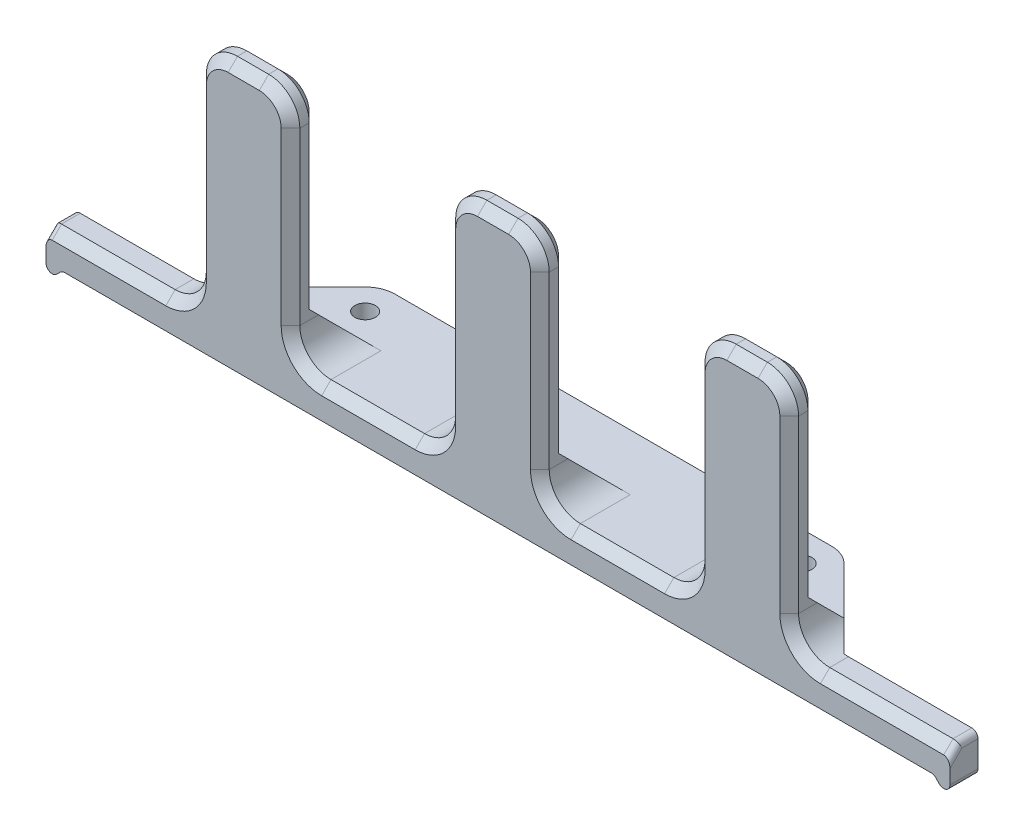
from build123d import *

# Parameters (mm, degrees)
BOSS_EXTRUDE1_DEPTH = 4.5
SKETCH2_R           = 1.6500000000000021
BOSS_EXTRUDE2_DEPTH = 3
CHAMFER1_SIZE       = 5
FILLET1_R           = 5
FILLET2_R           = 5
CHAMFER2_SIZE       = 1.5
CHAMFER3_SIZE       = 1.5
FILLET3_R           = 1


with BuildPart() as part:
    # Sketch1 → Boss-Extrude1 (new body)
    with BuildSketch(Plane.XY):
        Polygon((119.21826692136499, -13.385786437626857), (104.21826692136499, -13.38578643762686), (104.21826692136499, -50.8), (79.218266921365, -50.8), (79.218266921365, -13.385786437626857), (64.218266921365, -13.38578643762686), (64.218266921365, -50.8), (39.218266921365, -50.8), (39.21826692136499, -13.385786437627136), (24.218266921364993, -13.38578643762714), (24.21826692136499, -50.8), (0, -50.79999999999999), (0, -58.38578643762687), (2.5857864376269135, -55.8), (142.4142135623731, -55.8), (145, -58.38578643762691), (145, -50.8), (119.21826692136499, -50.8), align=None)
    extrude(amount=BOSS_EXTRUDE1_DEPTH)

    # Sketch2 → Boss-Extrude2 (add)
    with BuildSketch(Plane(origin=(0, -53.8, 0), x_dir=(1, 0, 0), z_dir=(0, 1, 0))):
        with BuildLine():
            Line((123.50544023729859, 2.968e-14), (110.90639087969068, 12.59904935760797))
            ThreePointArc((110.90639087969068, 12.59904935760797), (109.34915880534766, 13.639558563966734), (107.5122783299952, 14.004936807912568))
            Line((107.5122783299952, 14.004936807912568), (37.48772167000479, 14.004936807912571))
            ThreePointArc((37.48772167000479, 14.004936807912571), (35.65084119465232, 13.639558563966755), (34.093609120309296, 12.599049357607985))
            Line((34.093609120309296, 12.599049357607985), (21.4945597627013, -1.69e-15))
            Line((21.4945597627013, -1.69e-15), (123.50544023729859, 2.968e-14))
        make_face()
        with Locations(Location((37.48772167000473, 9.204936807912581, 0), (0, 0, 90))):
            Circle(SKETCH2_R, mode=Mode.SUBTRACT)
        with Locations(Location((107.51227832999525, 9.204936807912581, 0), (0, 0, 90))):
            Circle(SKETCH2_R, mode=Mode.SUBTRACT)
    extrude(amount=BOSS_EXTRUDE2_DEPTH)

    # Chamfer1
    # the kernel refuses this chamfer: 5 mm, written as the material it adds along each edge
    with BuildSketch(Plane(origin=(24.218266921364993, -50.8, 8.6e-16), x_dir=(0, -0.02749587661059184, -0.9996219169112965), z_dir=(1, 0, -3.1e-16))) as chamfer1_piece_1_section:
        Polygon((CHAMFER1_SIZE * 0.999621916911, CHAMFER1_SIZE * 0.0274958766106), (-CHAMFER1_SIZE * 0.0274958766106, CHAMFER1_SIZE * 0.999621916911), (0, 0), align=None)
    chamfer1_piece_1 = extrude(amount=15.000000000000007, mode=Mode.PRIVATE)
    chamfer1_piece_1 = split(chamfer1_piece_1, bisect_by=Plane(origin=(27.458586857581327, -49.136179349739656, -5.964027094880023), z_dir=(0.7071067811865472, 0, 0.7071067811865478)), keep=Keep.TOP, mode=Mode.PRIVATE)
    add(chamfer1_piece_1)
    with BuildSketch(Plane(origin=(64.218266921365, -50.8, -1.145e-14), x_dir=(0, -0.02749587661058908, -0.9996219169112968), z_dir=(1, 0, -3.1e-16))) as chamfer1_piece_2:
        Polygon((CHAMFER1_SIZE * 0.999621916911, CHAMFER1_SIZE * 0.0274958766106), (-CHAMFER1_SIZE * 0.0274958766106, CHAMFER1_SIZE * 0.999621916911), (0, 0), align=None)
    extrude(amount=15)
    with BuildSketch(Plane(origin=(104.21826692136499, -50.8, -2.375e-14), x_dir=(0, 0.9996219169112965, 0.027495876610591035), z_dir=(1, 0, -3.1e-16))) as chamfer1_piece_3_section:
        Polygon((CHAMFER1_SIZE * 0.999621916911, -CHAMFER1_SIZE * 0.0274958766106), (-CHAMFER1_SIZE * 0.0274958766106, -CHAMFER1_SIZE * 0.999621916911), (0, 0), align=None)
    chamfer1_piece_3 = extrude(amount=15, mode=Mode.PRIVATE)
    chamfer1_piece_3 = split(chamfer1_piece_3, bisect_by=Plane(origin=(116.78603436653776, -49.14998540496001, -6.719405870760873), z_dir=(-0.7071067811865483, 0, 0.7071067811865467)), keep=Keep.TOP, mode=Mode.PRIVATE)
    add(chamfer1_piece_3)

    # Fillet1
    fillet1_edges = [part.edges().sort_by_distance(p)[0] for p in [
        (39.218266921365, -50.80000000000099, -0.24999999999926015),
        (64.218266921365, -50.80000000000099, -0.24999999999926015),
        (79.218266921365, -50.80000000000099, -0.24999999999926015),
        (104.218266921365, -50.799999999999, -0.24999999999926015),
        (119.21826692136499, -50.799999999999145, 0.10641334203299913),
        (24.218266921364997, -50.80000000000054, 0.8881464206679999),
    ]]
    fillet(fillet1_edges, radius=FILLET1_R)

    # Fillet2
    fillet2_edges = [part.edges().sort_by_distance(p)[0] for p in [
        (24.218266921364993, -13.38578643762714, 2.25),
        (39.21826692136499, -13.385786437627136, 2.25),
        (64.218266921365, -13.38578643762686, 2.25),
        (79.218266921365, -13.385786437626857, 2.25),
        (104.21826692136499, -13.38578643762686, 2.25),
        (119.21826692136499, -13.385786437626855, 2.25),
    ]]
    fillet(fillet2_edges, radius=FILLET2_R)

    # Chamfer2
    # the kernel refuses this chamfer: 1.5 mm, written as the material it takes off along each edge
    with BuildSketch(Plane(origin=(114.218266921365, -13.385786437626859, 0), x_dir=(0, -0.9996219169112968, -0.02749587661058636), z_dir=(-1, -2.4e-16, 0))) as chamfer2_piece_1:
        Polygon((CHAMFER2_SIZE * 0.999621916911, CHAMFER2_SIZE * 0.0274958766106), (-CHAMFER2_SIZE * 0.0274958766106, CHAMFER2_SIZE * 0.999621916911), (0, 0), align=None)
    extrude(amount=5, mode=Mode.SUBTRACT)
    with BuildSketch(Plane(origin=(119.218266921365, -49.65752448195035, 0), x_dir=(0.02749587661058217, 0, 0.9996219169112969), z_dir=(0, 1, 0))) as chamfer2_piece_2_section:
        Polygon((CHAMFER2_SIZE * 0.999621916911, -CHAMFER2_SIZE * 0.0274958766106), (-CHAMFER2_SIZE * 0.0274958766106, -CHAMFER2_SIZE * 0.999621916911), (0, 0), align=None)
    chamfer2_piece_2 = extrude(amount=31.27173804432349, mode=Mode.PRIVATE)
    chamfer2_piece_2 = split(chamfer2_piece_2, bisect_by=Plane(origin=(118.72073896252428, -38.57940955340098, 7.220590446608273), z_dir=(0, 0.7071067811868302, -0.7071067811862648)), keep=Keep.TOP, mode=Mode.PRIVATE)
    add(chamfer2_piece_2, mode=Mode.SUBTRACT)
    with BuildSketch(Plane(origin=(104.21826692136499, -18.38578643762686, 0), x_dir=(0.9996219169112968, 0, -0.02749587661058662), z_dir=(0, -1, 0))) as chamfer2_piece_3_section:
        Polygon((CHAMFER2_SIZE * 0.999621916911, CHAMFER2_SIZE * 0.0274958766106), (-CHAMFER2_SIZE * 0.0274958766106, CHAMFER2_SIZE * 0.999621916911), (0, 0), align=None)
    chamfer2_piece_3 = extrude(amount=31.27173804432348, mode=Mode.PRIVATE)
    chamfer2_piece_3 = split(chamfer2_piece_3, bisect_by=Plane(origin=(104.71579488020573, -38.579409553400986, 7.220590446608265), z_dir=(0, 0.7071067811868302, -0.7071067811862648)), keep=Keep.TOP, mode=Mode.PRIVATE)
    add(chamfer2_piece_3, mode=Mode.SUBTRACT)
    with BuildSketch(Plane(origin=(109.218266921365, -18.385786437626862, 0), x_dir=(0, 1, 0), z_dir=(1, 0, 0))) as chamfer2_piece_4:
        Polygon((5 - CHAMFER2_SIZE, 0), (5, CHAMFER2_SIZE), (5, 0), align=None)
    revolve(axis=Axis((109.218266921365, -18.385786437626862, 0), (0, 0, 1)), revolution_arc=90, mode=Mode.SUBTRACT)
    with BuildSketch(Plane(origin=(114.218266921365, -18.385786437626855, 0), x_dir=(1, 0, 0), z_dir=(0, -1, 0))) as chamfer2_piece_5:
        Polygon((5, CHAMFER2_SIZE), (5 - CHAMFER2_SIZE, 0), (5, 0), align=None)
    revolve(axis=Axis((114.218266921365, -18.385786437626855, 0), (0, 0, 1)), revolution_arc=90, mode=Mode.SUBTRACT)
    with BuildSketch(Plane(origin=(74.218266921365, -13.385786437626859, 0), x_dir=(0, 0.027495876610586778, 0.9996219169112968), z_dir=(-1, -2.4e-16, 0))) as chamfer2_piece_6:
        Polygon((CHAMFER2_SIZE * 0.999621916911, -CHAMFER2_SIZE * 0.0274958766106), (-CHAMFER2_SIZE * 0.0274958766106, -CHAMFER2_SIZE * 0.999621916911), (0, 0), align=None)
    extrude(amount=5, mode=Mode.SUBTRACT)
    with BuildSketch(Plane(origin=(79.218266921365, -49.65752448195035, 0), x_dir=(0.027495876610582157, 0, 0.9996219169112969), z_dir=(0, 1, 0))) as chamfer2_piece_7_section:
        Polygon((CHAMFER2_SIZE * 0.999621916911, -CHAMFER2_SIZE * 0.0274958766106), (-CHAMFER2_SIZE * 0.0274958766106, -CHAMFER2_SIZE * 0.999621916911), (0, 0), align=None)
    chamfer2_piece_7 = extrude(amount=31.27173804432349, mode=Mode.PRIVATE)
    chamfer2_piece_7 = split(chamfer2_piece_7, bisect_by=Plane(origin=(78.72073896252427, -38.579409553386625, 7.220590446607076), z_dir=(0, 0.7071067811862648, -0.7071067811868302)), keep=Keep.TOP, mode=Mode.PRIVATE)
    add(chamfer2_piece_7, mode=Mode.SUBTRACT)
    with BuildSketch(Plane(origin=(64.218266921365, -18.38578643762686, 0), x_dir=(-0.02749587661058215, 0, 0.9996219169112969), z_dir=(0, -1, 0))) as chamfer2_piece_8_section:
        Polygon((CHAMFER2_SIZE * 0.999621916911, -CHAMFER2_SIZE * 0.0274958766106), (-CHAMFER2_SIZE * 0.0274958766106, -CHAMFER2_SIZE * 0.999621916911), (0, 0), align=None)
    chamfer2_piece_8 = extrude(amount=31.27173804432348, mode=Mode.PRIVATE)
    chamfer2_piece_8 = split(chamfer2_piece_8, bisect_by=Plane(origin=(64.71579488020572, -38.57940955338663, 7.220590446607069), z_dir=(0, 0.7071067811862648, -0.7071067811868302)), keep=Keep.TOP, mode=Mode.PRIVATE)
    add(chamfer2_piece_8, mode=Mode.SUBTRACT)
    with BuildSketch(Plane(origin=(69.218266921365, -18.385786437626862, 0), x_dir=(-1, 0, 0), z_dir=(0, -1, 0))) as chamfer2_piece_9:
        Polygon((5, -CHAMFER2_SIZE), (5 - CHAMFER2_SIZE, 0), (5, 0), align=None)
    revolve(axis=Axis((69.218266921365, -18.385786437626862, 0), (0, 0, -1)), revolution_arc=90, mode=Mode.SUBTRACT)
    with BuildSketch(Plane(origin=(74.218266921365, -18.385786437626855, 0), x_dir=(0, 1, 0), z_dir=(-1, 0, 0))) as chamfer2_piece_10:
        Polygon((5, -CHAMFER2_SIZE), (5 - CHAMFER2_SIZE, 0), (5, 0), align=None)
    revolve(axis=Axis((74.218266921365, -18.385786437626855, 0), (0, 0, -1)), revolution_arc=90, mode=Mode.SUBTRACT)
    with BuildSketch(Plane(origin=(34.218266921365, -13.385786437627138, 0), x_dir=(0, 0.027495876610586778, 0.9996219169112968), z_dir=(-1, -2.4e-16, 0))) as chamfer2_piece_11:
        Polygon((CHAMFER2_SIZE * 0.999621916911, -CHAMFER2_SIZE * 0.0274958766106), (-CHAMFER2_SIZE * 0.0274958766106, -CHAMFER2_SIZE * 0.999621916911), (0, 0), align=None)
    extrude(amount=5, mode=Mode.SUBTRACT)
    with BuildSketch(Plane(origin=(39.218266921365, -49.65752448195034, 0), x_dir=(0.027495876610586757, 0, 0.9996219169112968), z_dir=(0, 1, 0))) as chamfer2_piece_12_section:
        Polygon((CHAMFER2_SIZE * 0.999621916911, -CHAMFER2_SIZE * 0.0274958766106), (-CHAMFER2_SIZE * 0.0274958766106, -CHAMFER2_SIZE * 0.999621916911), (0, 0), align=None)
    chamfer2_piece_12 = extrude(amount=31.2717380443232, mode=Mode.PRIVATE)
    chamfer2_piece_12 = split(chamfer2_piece_12, bisect_by=Plane(origin=(38.72073896252428, -38.579409553386704, 7.220590446606996), z_dir=(0, 0.7071067811862648, -0.7071067811868302)), keep=Keep.TOP, mode=Mode.PRIVATE)
    add(chamfer2_piece_12, mode=Mode.SUBTRACT)
    with BuildSketch(Plane(origin=(24.218266921364993, -18.38578643762714, 0), x_dir=(-0.027495876610582153, 0, 0.9996219169112969), z_dir=(-9e-17, -1, 0))) as chamfer2_piece_13_section:
        Polygon((CHAMFER2_SIZE * 0.999621916911, -CHAMFER2_SIZE * 0.0274958766106), (-CHAMFER2_SIZE * 0.0274958766106, -CHAMFER2_SIZE * 0.999621916911), (0, 0), align=None)
    chamfer2_piece_13 = extrude(amount=31.271738044323207, mode=Mode.PRIVATE)
    chamfer2_piece_13 = split(chamfer2_piece_13, bisect_by=Plane(origin=(24.71579488020572, -38.57940955338671, 7.220590446606995), z_dir=(0, 0.7071067811862648, -0.7071067811868302)), keep=Keep.TOP, mode=Mode.PRIVATE)
    add(chamfer2_piece_13, mode=Mode.SUBTRACT)
    with BuildSketch(Plane(origin=(29.218266921365, -18.38578643762714, 0), x_dir=(-1, 0, 0), z_dir=(0, -1, 0))) as chamfer2_piece_14:
        Polygon((5, -CHAMFER2_SIZE), (5 - CHAMFER2_SIZE, 0), (5, 0), align=None)
    revolve(axis=Axis((29.218266921365, -18.38578643762714, 0), (0, 0, -1)), revolution_arc=90, mode=Mode.SUBTRACT)
    with BuildSketch(Plane(origin=(34.218266921365, -18.38578643762714, 0), x_dir=(0, 1, 0), z_dir=(-1, 0, 0))) as chamfer2_piece_15:
        Polygon((5, -CHAMFER2_SIZE), (5 - CHAMFER2_SIZE, 0), (5, 0), align=None)
    revolve(axis=Axis((34.218266921365, -18.38578643762714, 0), (0, 0, -1)), revolution_arc=90, mode=Mode.SUBTRACT)

    # Chamfer3
    chamfer3_edges = [part.edges().sort_by_distance(p)[0] for p in [
        (51.718266921365, -50.8, 4.5),
        (9.609133460682495, -50.79999999999999, 4.5),
        (40.68273301543226, -49.335533905932756, 4.500000000000743),
        (22.75380082729773, -49.335533905931676, 4.500000000000536),
        (62.75380082729774, -49.33553390593275, 4.500000000000743),
        (80.68273301543226, -49.33553390593075, 4.500000000000743),
        (120.68273301543226, -49.335533905932735, 4.4999999999993054),
        (102.75380082729772, -49.33553390593474, 4.499999999999262),
        (111.718266921365, -13.385786437626859, 4.5),
        (119.21826692136499, -32.09289321881342, 4.5),
        (24.218266921364993, -32.09289321881304, 4.5),
        (104.21826692136499, -32.09289321881443, 4.5),
        (79.218266921365, -32.092893218812435, 4.5),
        (71.718266921365, -13.385786437626859, 4.5),
        (64.218266921365, -32.09289321881344, 4.5),
        (39.21826692136499, -32.09289321881358, 4.5),
        (31.718266921365, -13.385786437627138, 4.5),
        (25.682733015432262, -14.850252531694402, 4.5),
        (37.75380082729774, -14.850252531694402, 4.5),
        (65.68273301543226, -14.850252531694125, 4.5),
        (77.75380082729774, -14.850252531694117, 4.5),
        (105.68273301543226, -14.850252531694125, 4.5),
        (117.75380082729774, -14.850252531694117, 4.5),
        (134.6091334606825, -50.79999999999999, 4.5),
    ]]
    chamfer(chamfer3_edges, length=CHAMFER3_SIZE)

    # Fillet3
    fillet3_edges = [part.edges().sort_by_distance(p)[0] for p in [
        (145, -58.38578643762691, 2.25),
        (142.4142135623731, -55.8, 2.25),
        (2.5857864376269135, -55.8, 2.25),
        (0, -58.38578643762687, 2.25),
        (0, -50.8, 1.4999999999999982),
        (-1.78e-15, -51.55000000000001, 3.749999999999994),
        (145, -50.8, 1.4999999999999996),
        (145, -51.54999999999999, 3.749999999999999),
    ]]
    fillet(fillet3_edges, radius=FILLET3_R)


solid = part.part
